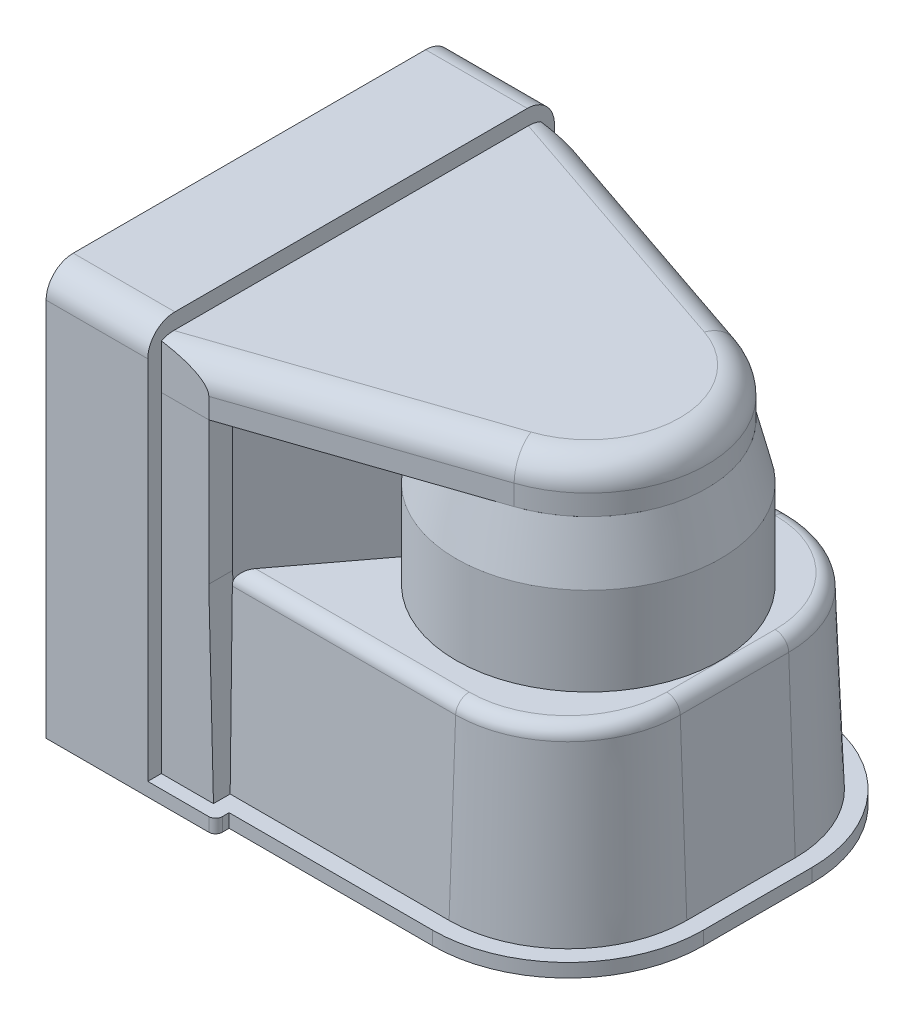
from build123d import *

# Parameters (mm, degrees)
ESQUISSE1_W        = 60
ESQUISSE1_H        = 60
ESQUISSE1_R        = 2
BOSS_EXTRU_1_DEPTH = 15
BOSS_EXTRU_2_DEPTH = 2
BOSS_EXTRU_3_DEPTH = 27.7
CHANFREIN1_SIZE    = 1.5
CHANFREIN1_SIZE_2  = 40
CHANFREIN2_SIZE    = 1
CHANFREIN2_SIZE_2  = 40
BOSS_EXTRU_4_DEPTH = 21
ESQUISSE5_R        = 19.5
BOSS_EXTRU_5_DEPTH = 13
ESQUISSE6_R        = 19.5
BOSS_EXTRU_6_DEPTH = 8
CHANFREIN3_SIZE    = 8
CHANFREIN3_SIZE_2  = 2
BOSS_EXTRU_9_DEPTH = 7
CONG_3_R           = 2
CONG_4_R           = 4
CONG_5_R           = 4


with BuildPart() as part:
    # Esquisse1 → Boss.-Extru.1 (new body)
    with BuildSketch(Plane(origin=(0, 0, 0), x_dir=(0, 0, -1), z_dir=(1, 0, 0))):
        with Locations((30, 30)):
            Rectangle(ESQUISSE1_W, ESQUISSE1_H)
        with Locations((7, 23)):
            Circle(ESQUISSE1_R, mode=Mode.SUBTRACT)
        with Locations((53, 23)):
            Circle(ESQUISSE1_R, mode=Mode.SUBTRACT)
    extrude(amount=BOSS_EXTRU_1_DEPTH)

    # Esquisse2 → Boss.-Extru.2 (add)
    with BuildSketch(Plane.XZ):
        with BuildLine():
            Line((15, 0), (24, 0))
            ThreePointArc((24, 0), (24.707106781, -0.292893219), (25, -1))
            Line((25, -1), (25, -2))
            Line((25, -2), (55, -2))
            ThreePointArc((55, -2), (69.142135624, -7.857864376), (75, -22))
            Line((75, -22), (75, -38))
            ThreePointArc((75, -38), (69.142135624, -52.142135624), (55, -58))
            Line((55, -58), (25, -58))
            Line((25, -58), (25, -59))
            ThreePointArc((25, -59), (24.707106781, -59.707106781), (24, -60))
            Line((24, -60), (15, -60))
            Line((15, -60), (15, 0))
        make_face()
    extrude(amount=-BOSS_EXTRU_2_DEPTH)

    # Esquisse3 → Boss.-Extru.3 (add)
    with BuildSketch(Plane(origin=(0, 2, 0), x_dir=(1, 0, 0), z_dir=(0, 1, 0))):
        with BuildLine():
            Line((23, 2), (15, 2))
            Line((15, 2), (15, 58))
            Line((15, 58), (23, 58))
            Line((23, 58), (23, 56))
            Line((23, 56), (55, 56))
            ThreePointArc((55, 56), (67.727922061, 50.727922061), (73, 38))
            Line((73, 38), (73, 22))
            ThreePointArc((73, 22), (67.727922061, 9.272077939), (55, 4))
            Line((55, 4), (23, 4))
            Line((23, 4), (23, 2))
        make_face()
    extrude(amount=BOSS_EXTRU_3_DEPTH)

    # Chanfrein1
    # the kernel refuses this chamfer: 40, 1.5 mm, written as the material it takes off along each edge
    with BuildSketch(Plane(origin=(23, 29.7, -56), x_dir=(0, 0.7157643485721592, 0.6983418914207227), z_dir=(1, 0, 0))) as chanfrein1_piece_1_section:
        Polygon((CHANFREIN1_SIZE * 0.698341891421, CHANFREIN1_SIZE * 0.715764348572), (-CHANFREIN1_SIZE_2 * 0.715764348572, CHANFREIN1_SIZE_2 * 0.698341891421), (0, 0), align=None)
    chanfrein1_piece_1 = extrude(amount=32, mode=Mode.PRIVATE)
    chanfrein1_piece_1 = split(chanfrein1_piece_1, bisect_by=Plane(origin=(37.024131868, 2, -55.4897808), z_dir=(0, 1, 0)), keep=Keep.TOP, mode=Mode.PRIVATE)
    add(chanfrein1_piece_1, mode=Mode.SUBTRACT)
    with BuildSketch(Plane(origin=(55, 29.7, -38), x_dir=(0, 0, -1), z_dir=(-1, 0, 0))) as chanfrein1_piece_2_section:
        Polygon((18 - CHANFREIN1_SIZE, 0), (18, CHANFREIN1_SIZE_2), (18, 0), align=None)
    chanfrein1_piece_2 = revolve(axis=Axis((55, 29.7, -38), (0, -1, 0)), revolution_arc=90, mode=Mode.PRIVATE)
    chanfrein1_piece_2 = split(chanfrein1_piece_2, bisect_by=Plane(origin=(67.098576513, 2, -50.098576513), z_dir=(0, 1, 0)), keep=Keep.TOP, mode=Mode.PRIVATE)
    add(chanfrein1_piece_2, mode=Mode.SUBTRACT)
    with BuildSketch(Plane(origin=(55, 29.7, -4), x_dir=(0, 0.7157643485721598, -0.698341891420722), z_dir=(-1, 0, 0))) as chanfrein1_piece_3_section:
        Polygon((CHANFREIN1_SIZE * 0.698341891421, CHANFREIN1_SIZE * 0.715764348572), (-CHANFREIN1_SIZE_2 * 0.715764348572, CHANFREIN1_SIZE_2 * 0.698341891421), (0, 0), align=None)
    chanfrein1_piece_3 = extrude(amount=32, mode=Mode.PRIVATE)
    chanfrein1_piece_3 = split(chanfrein1_piece_3, bisect_by=Plane(origin=(52.691459865, 2, -4.656531492), z_dir=(0, 1, 0)), keep=Keep.TOP, mode=Mode.PRIVATE)
    add(chanfrein1_piece_3, mode=Mode.SUBTRACT)
    with BuildSketch(Plane(origin=(73, 29.7, -38), x_dir=(-0.6983418914207212, 0.7157643485721609, 0), z_dir=(0, 0, 1))) as chanfrein1_piece_4_section:
        Polygon((CHANFREIN1_SIZE * 0.698341891421, CHANFREIN1_SIZE * 0.715764348572), (-CHANFREIN1_SIZE_2 * 0.715764348572, CHANFREIN1_SIZE_2 * 0.698341891421), (0, 0), align=None)
    chanfrein1_piece_4 = extrude(amount=16, mode=Mode.PRIVATE)
    chanfrein1_piece_4 = split(chanfrein1_piece_4, bisect_by=Plane(origin=(72.334165333, 2, -35.67535471), z_dir=(0, 1, 0)), keep=Keep.TOP, mode=Mode.PRIVATE)
    add(chanfrein1_piece_4, mode=Mode.SUBTRACT)
    with BuildSketch(Plane(origin=(55, 29.7, -22), x_dir=(1, 0, 0), z_dir=(0, 0, -1))) as chanfrein1_piece_5_section:
        Polygon((18 - CHANFREIN1_SIZE, 0), (18, CHANFREIN1_SIZE_2), (18, 0), align=None)
    chanfrein1_piece_5 = revolve(axis=Axis((55, 29.7, -22), (0, -1, 0)), revolution_arc=90, mode=Mode.PRIVATE)
    chanfrein1_piece_5 = split(chanfrein1_piece_5, bisect_by=Plane(origin=(67.098576513, 2, -9.901423487), z_dir=(0, 1, 0)), keep=Keep.TOP, mode=Mode.PRIVATE)
    add(chanfrein1_piece_5, mode=Mode.SUBTRACT)

    # Chanfrein2
    # the kernel refuses this chamfer: 40, 1 mm, written as the material it takes off along each edge
    with BuildSketch(Plane(origin=(23, 29.7, 49.498798633), x_dir=(-0.5451034374320658, 0.8383687986201215, 0), z_dir=(0, 0, -1))) as chanfrein2_piece_1_section:
        Polygon((CHANFREIN2_SIZE * 0.545103437432, -CHANFREIN2_SIZE * 0.83836879862), (-CHANFREIN2_SIZE_2 * 0.83836879862, -CHANFREIN2_SIZE_2 * 0.545103437432), (0, 0), align=None)
    chanfrein2_piece_1 = extrude(amount=211.497597266, mode=Mode.PRIVATE)
    chanfrein2_piece_1 = split(chanfrein2_piece_1, bisect_by=Plane(origin=(22.633717158, 2, -3.549424262), z_dir=(0, 1, 0)), keep=Keep.TOP, mode=Mode.PRIVATE)
    chanfrein2_piece_1 = split(chanfrein2_piece_1, bisect_by=Plane(origin=(22.633717158, 18.944605509, -5.096672707), z_dir=(0, 0.03747366058909413, 0.9992976157091807)), keep=Keep.TOP, mode=Mode.PRIVATE)
    add(chanfrein2_piece_1, mode=Mode.SUBTRACT)
    with BuildSketch(Plane(origin=(23, 29.7, 49.498798633), x_dir=(-0.5451034374320658, 0.8383687986201215, 0), z_dir=(0, 0, -1))) as chanfrein2_piece_2_section:
        Polygon((CHANFREIN2_SIZE * 0.545103437432, -CHANFREIN2_SIZE * 0.83836879862), (-CHANFREIN2_SIZE_2 * 0.83836879862, -CHANFREIN2_SIZE_2 * 0.545103437432), (0, 0), align=None)
    chanfrein2_piece_2 = extrude(amount=211.497597266, mode=Mode.PRIVATE)
    chanfrein2_piece_2 = split(chanfrein2_piece_2, bisect_by=Plane(origin=(22.633717158, 2, -56.450575738), z_dir=(0, 1, 0)), keep=Keep.TOP, mode=Mode.PRIVATE)
    chanfrein2_piece_2 = split(chanfrein2_piece_2, bisect_by=Plane(origin=(22.633717158, 18.944605509, -54.903327293), z_dir=(0, 0.03747366058909413, -0.9992976157091807)), keep=Keep.TOP, mode=Mode.PRIVATE)
    add(chanfrein2_piece_2, mode=Mode.SUBTRACT)
    with BuildSketch(Plane(origin=(23, 29.7, 101.998798633), x_dir=(-0.5451034374320658, 0.8383687986201215, -1.1066265363005755e-15), z_dir=(0, 0, -1))) as chanfrein2_piece_3_section:
        Polygon((CHANFREIN2_SIZE * 0.545103437432, -CHANFREIN2_SIZE * 0.83836879862), (-CHANFREIN2_SIZE_2 * 0.83836879862, -CHANFREIN2_SIZE_2 * 0.545103437432), (0, 0), align=None)
    chanfrein2_piece_3 = extrude(amount=211.497597266, mode=Mode.PRIVATE)
    chanfrein2_piece_3 = split(chanfrein2_piece_3, bisect_by=Plane(origin=(22.633717158, 2, -3.549424262), z_dir=(0, 1, 0)), keep=Keep.TOP, mode=Mode.PRIVATE)
    chanfrein2_piece_3 = split(chanfrein2_piece_3, bisect_by=Plane(origin=(22.633717158, 18.944605509, -5.096672707), z_dir=(0, 0.03747366058909413, 0.9992976157091807)), keep=Keep.TOP, mode=Mode.PRIVATE)
    add(chanfrein2_piece_3, mode=Mode.SUBTRACT)
    with BuildSketch(Plane(origin=(23, 29.7, 101.998798633), x_dir=(-0.5451034374320658, 0.8383687986201215, -1.1066265363005755e-15), z_dir=(0, 0, -1))) as chanfrein2_piece_4_section:
        Polygon((CHANFREIN2_SIZE * 0.545103437432, -CHANFREIN2_SIZE * 0.83836879862), (-CHANFREIN2_SIZE_2 * 0.83836879862, -CHANFREIN2_SIZE_2 * 0.545103437432), (0, 0), align=None)
    chanfrein2_piece_4 = extrude(amount=211.497597266, mode=Mode.PRIVATE)
    chanfrein2_piece_4 = split(chanfrein2_piece_4, bisect_by=Plane(origin=(22.633717158, 2, -56.450575738), z_dir=(0, 1, 0)), keep=Keep.TOP, mode=Mode.PRIVATE)
    chanfrein2_piece_4 = split(chanfrein2_piece_4, bisect_by=Plane(origin=(22.633717158, 18.944605509, -54.903327293), z_dir=(0, 0.03747366058909413, -0.9992976157091807)), keep=Keep.TOP, mode=Mode.PRIVATE)
    add(chanfrein2_piece_4, mode=Mode.SUBTRACT)

    # Esquisse4 → Boss.-Extru.4 (add)
    with BuildSketch(Plane(origin=(0, 29.7, 0), x_dir=(1, 0, 0), z_dir=(0, 1, 0))):
        with BuildLine():
            Line((22, 54.5), (33.112504626, 39.75))
            ThreePointArc((33.112504626, 39.75), (30.5, 30), (33.112504626, 20.25))
            Line((33.112504626, 20.25), (22, 5.5))
            Line((22, 5.5), (22, 2))
            Line((22, 2), (15, 2))
            Line((15, 2), (15, 58))
            Line((15, 58), (22, 58))
            Line((22, 58), (22, 54.5))
        make_face()
    extrude(amount=BOSS_EXTRU_4_DEPTH)

    # Congé3
    # the kernel refuses this fillet: 2 mm, written as the material it takes off along each edge
    with BuildSketch(Plane(origin=(55, 29.7, -22), x_dir=(1, 0, 0), z_dir=(0, 0, -1))) as cong_3_piece_1:
        with BuildLine():
            CenterArc((16.5 - CONG_3_R * 0.963202877981, CONG_3_R), CONG_3_R, 270, 87.852414572)
            Line((16.5 - CONG_3_R * 0.963202877981, 0), (16.5, 0))
            Line((16.5, 0), (16.5 + CONG_3_R * 0.0360947377279, CONG_3_R * 0.962526339411))
        make_face()
    revolve(axis=Axis((55, 29.7, -22), (0, -1, 0)), revolution_arc=90, mode=Mode.SUBTRACT)
    with BuildSketch(Plane(origin=(71.5, 29.7, -38), x_dir=(0.03747366058909278, -0.9992976157091809, 0), z_dir=(0, 0, 1))) as cong_3_piece_2:
        with BuildLine():
            CenterArc((CONG_3_R * 0.963202877981, -CONG_3_R), CONG_3_R, 90, 87.852414572)
            Line((-CONG_3_R * 0.0360947377279, -CONG_3_R * 0.962526339411), (0, 0))
            Line((0, 0), (CONG_3_R * 0.963202877981, 0))
        make_face()
    extrude(amount=16, mode=Mode.SUBTRACT)
    with BuildSketch(Plane(origin=(55, 29.7, -5.5), x_dir=(1.1487780265352356e-15, -0.9992976157091819, 0.037473660589062784), z_dir=(-1, 0, 0))) as cong_3_piece_3_section:
        with BuildLine():
            CenterArc((CONG_3_R * 0.963202877981, -CONG_3_R), CONG_3_R, 90, 87.852414572)
            Line((-CONG_3_R * 0.0360947377279, -CONG_3_R * 0.962526339411), (0, 0))
            Line((0, 0), (CONG_3_R * 0.963202877981, 0))
        make_face()
    cong_3_piece_3 = extrude(amount=37.81601439, mode=Mode.PRIVATE)
    cong_3_piece_3 = split(cong_3_piece_3, bisect_by=Plane(origin=(22.021307393, 28.847704283, -5.913963971), z_dir=(0.9996876464081229, 0.024992191160203014, 0)), keep=Keep.TOP, mode=Mode.PRIVATE)
    cong_3_piece_3 = split(cong_3_piece_3, bisect_by=Plane(origin=(28.231231543, 29.263672501, -13.770922565), z_dir=(0.7986984257525773, 0, 0.6017315221096157)), keep=Keep.TOP, mode=Mode.PRIVATE)
    add(cong_3_piece_3, mode=Mode.SUBTRACT)
    with BuildSketch(Plane(origin=(55, 29.7, -38), x_dir=(0, 0, -1), z_dir=(-1, 0, 0))) as cong_3_piece_4:
        with BuildLine():
            CenterArc((16.5 - CONG_3_R * 0.963202877981, CONG_3_R), CONG_3_R, 270, 87.852414572)
            Line((16.5 - CONG_3_R * 0.963202877981, 0), (16.5, 0))
            Line((16.5, 0), (16.5 + CONG_3_R * 0.0360947377279, CONG_3_R * 0.962526339411))
        make_face()
    revolve(axis=Axis((55, 29.7, -38), (0, -1, 0)), revolution_arc=90, mode=Mode.SUBTRACT)
    with BuildSketch(Plane(origin=(17.18398561, 29.7, -54.5), x_dir=(1.1457522722959319e-15, -0.9992976157091807, -0.03747366058909278), z_dir=(1, 0, 0))) as cong_3_piece_5_section:
        with BuildLine():
            CenterArc((CONG_3_R * 0.963202877981, -CONG_3_R), CONG_3_R, 90, 87.852414572)
            Line((-CONG_3_R * 0.0360947377279, -CONG_3_R * 0.962526339411), (0, 0))
            Line((0, 0), (CONG_3_R * 0.963202877981, 0))
        make_face()
    cong_3_piece_5 = extrude(amount=37.81601439, mode=Mode.PRIVATE)
    cong_3_piece_5 = split(cong_3_piece_5, bisect_by=Plane(origin=(22.021307393, 28.847704283, -54.086036029), z_dir=(0.9996876464081229, 0.024992191160203014, 0)), keep=Keep.TOP, mode=Mode.PRIVATE)
    cong_3_piece_5 = split(cong_3_piece_5, bisect_by=Plane(origin=(28.231231543, 29.263672501, -46.229077435), z_dir=(0.798698425752577, 0, -0.6017315221096161)), keep=Keep.TOP, mode=Mode.PRIVATE)
    add(cong_3_piece_5, mode=Mode.SUBTRACT)

    # Congé5
    cong_5_edges = [part.edges().sort_by_distance(p)[0] for p in [
        (7.5, 60, 0),
        (7.5, 60, -60),
    ]]
    fillet(cong_5_edges, radius=CONG_5_R)


with BuildPart() as body_2:
    # Esquisse5 → Boss.-Extru.5 (new body)
    with BuildSketch(Plane(origin=(0, 29.7, 0), x_dir=(1, 0, 0), z_dir=(0, 1, 0))):
        with Locations(Location((50, 30, 0), (0, 0, 90))):
            Circle(ESQUISSE5_R)
    extrude(amount=BOSS_EXTRU_5_DEPTH)


with BuildPart() as body_3:
    # Esquisse6 → Boss.-Extru.6 (new body)
    with BuildSketch(Plane(origin=(0, 42.7, 0), x_dir=(1, 0, 0), z_dir=(0, 1, 0))):
        with Locations(Location((50, 30, 0), (0, 0, 270))):
            Circle(ESQUISSE6_R)
    extrude(amount=BOSS_EXTRU_6_DEPTH)

    # Chanfrein3
    # the kernel refuses this chamfer: 8, 2 mm, written as the material it takes off along each edge
    with BuildSketch(Plane(origin=(50, 50.7, -30), x_dir=(0, 0, 1), z_dir=(-1, 0, 0))) as chanfrein3_piece_1:
        Polygon((19.5, -CHANFREIN3_SIZE), (19.5 - CHANFREIN3_SIZE_2, 0), (19.5, 0), align=None)
    revolve(axis=Axis((50, 50.7, -30), (0, 1, 0)), mode=Mode.SUBTRACT)


with BuildPart() as body_4:
    # Esquisse8 → Boss.-Extru.9 (new body)
    with BuildSketch(Plane(origin=(0, 50.7, 0), x_dir=(1, 0, 0), z_dir=(0, 1, 0))):
        with BuildLine():
            Line((15, 2), (22, 2))
            Line((22, 2), (55.631600149, 13.430899851))
            ThreePointArc((55.631600149, 13.430899851), (67.5, 30), (55.631600149, 46.569100149))
            Line((55.631600149, 46.569100149), (22, 58))
            Line((22, 58), (15, 58))
            Line((15, 58), (15, 2))
        make_face()
    extrude(amount=BOSS_EXTRU_9_DEPTH)

    # Congé4
    cong_4_edges = [body_4.edges().sort_by_distance(p)[0] for p in [
        (38.815800075, 57.7, -7.715449925),
        (38.815800075, 57.7, -52.284550075),
        (67.5, 57.7, -30),
    ]]
    fillet(cong_4_edges, radius=CONG_4_R)


solid = Compound([part.part, body_2.part, body_3.part, body_4.part])
